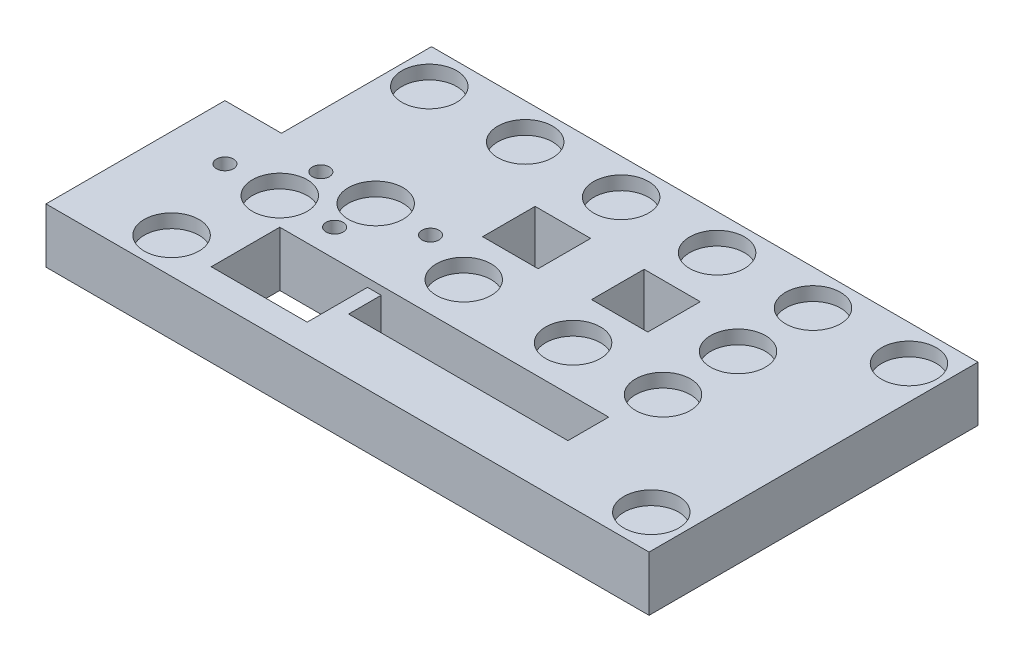
from build123d import *

# Parameters (mm, degrees)
SKETCH1_W               = 220
SKETCH1_H               = 120
BOSS_EXTRUDE1_DEPTH     = 20
CUT_EXTRUDE1_REACH      = 128.886
SKETCH2_W               = 20.632503002
SKETCH2_H               = 54.730004003
CUT_EXTRUDE2_REACH      = 128.886
SKETCH3_W               = 20.25
SKETCH3_H               = 19.16
SKETCH3_W_2             = 20.5
CUT_EXTRUDE3_REACH      = 128.886
SKETCH4_W               = 80
SKETCH4_H               = 14.88
CUT_EXTRUDE4_REACH      = 128.886
SKETCH8_R               = 3.1
CUT_EXTRUDE5_REACH      = 128.886
CUT_EXTRUDE6_DEPTH      = 127.885775404
CUT_EXTRUDE6_DEPTH_BACK = 5
SKETCH10_R              = 10


with BuildPart() as part:
    # Sketch1 → Boss-Extrude1 (new body)
    with BuildSketch(Plane(origin=(0, 0, 0), x_dir=(1, 0, 0), z_dir=(0, 1, 0))):
        Rectangle(SKETCH1_W, SKETCH1_H)
    extrude(amount=-BOSS_EXTRUDE1_DEPTH)

    # Sketch2 → Cut-Extrude1 (cut, up to next)
    with BuildSketch(Plane(origin=(0, 0, 0), x_dir=(1, 0, 0), z_dir=(0, 1, 0)), mode=Mode.PRIVATE) as cut_extrude1_sk1:
        with Locations((-99.683748499, 32.634997999)):
            Rectangle(SKETCH2_W, SKETCH2_H)
    cut_extrude1_tool1 = extrude(cut_extrude1_sk1.sketch, amount=-CUT_EXTRUDE1_REACH, mode=Mode.PRIVATE) & part.part
    add(cut_extrude1_tool1.solids().sort_by_distance((-99.683748, 0, -32.634998))[0], mode=Mode.SUBTRACT)

    # Sketch3 → Cut-Extrude2 (cut, up to next)
    with BuildSketch(Plane(origin=(0, 0, 0), x_dir=(1, 0, 0), z_dir=(0, 1, 0)), mode=Mode.PRIVATE) as cut_extrude2_sk1:
        with Locations((-9.875, 18.86)):
            Rectangle(SKETCH3_W, SKETCH3_H)
    cut_extrude2_tool1 = extrude(cut_extrude2_sk1.sketch, amount=-CUT_EXTRUDE2_REACH, mode=Mode.PRIVATE) & part.part
    # Sketch3 → Cut-Extrude2 (cut, up to next)
    with BuildSketch(Plane(origin=(0, 0, 0), x_dir=(1, 0, 0), z_dir=(0, 1, 0)), mode=Mode.PRIVATE) as cut_extrude2_sk2:
        with Locations((30, 18.86)):
            Rectangle(SKETCH3_W_2, SKETCH3_H)
    cut_extrude2_tool2 = extrude(cut_extrude2_sk2.sketch, amount=-CUT_EXTRUDE2_REACH, mode=Mode.PRIVATE) & part.part
    add(cut_extrude2_tool1.solids().sort_by_distance((-9.875, 0, -18.86))[0], mode=Mode.SUBTRACT)
    add(cut_extrude2_tool2.solids().sort_by_distance((30, 0, -18.86))[0], mode=Mode.SUBTRACT)

    # Sketch4 → Cut-Extrude3 (cut, up to next)
    with BuildSketch(Plane(origin=(0, 0, 0), x_dir=(1, 0, 0), z_dir=(0, 1, 0)), mode=Mode.PRIVATE) as cut_extrude3_sk1:
        with Locations((20, -32.16)):
            Rectangle(SKETCH4_W, SKETCH4_H)
    cut_extrude3_tool1 = extrude(cut_extrude3_sk1.sketch, amount=-CUT_EXTRUDE3_REACH, mode=Mode.PRIVATE) & part.part
    add(cut_extrude3_tool1.solids().sort_by_distance((20, 0, 32.16))[0], mode=Mode.SUBTRACT)

    # Sketch8 → Cut-Extrude4 (cut, up to next)
    with BuildSketch(Plane(origin=(0, 0, 0), x_dir=(1, 0, 0), z_dir=(0, 1, 0)), mode=Mode.PRIVATE) as cut_extrude4_sk1:
        with Locations((-90, -14.72)):
            Circle(SKETCH8_R)
    cut_extrude4_tool1 = extrude(cut_extrude4_sk1.sketch, amount=-CUT_EXTRUDE4_REACH, mode=Mode.PRIVATE) & part.part
    # Sketch8 → Cut-Extrude4 (cut, up to next)
    with BuildSketch(Plane(origin=(0, 0, 0), x_dir=(1, 0, 0), z_dir=(0, 1, 0)), mode=Mode.PRIVATE) as cut_extrude4_sk2:
        with Locations((-30, 0.28)):
            Circle(SKETCH8_R)
    cut_extrude4_tool2 = extrude(cut_extrude4_sk2.sketch, amount=-CUT_EXTRUDE4_REACH, mode=Mode.PRIVATE) & part.part
    # Sketch8 → Cut-Extrude4 (cut, up to next)
    with BuildSketch(Plane(origin=(0, 0, 0), x_dir=(1, 0, 0), z_dir=(0, 1, 0)), mode=Mode.PRIVATE) as cut_extrude4_sk3:
        with Locations((-70, 0.28)):
            Circle(SKETCH8_R)
    cut_extrude4_tool3 = extrude(cut_extrude4_sk3.sketch, amount=-CUT_EXTRUDE4_REACH, mode=Mode.PRIVATE) & part.part
    # Sketch8 → Cut-Extrude4 (cut, up to next)
    with BuildSketch(Plane(origin=(0, 0, 0), x_dir=(1, 0, 0), z_dir=(0, 1, 0)), mode=Mode.PRIVATE) as cut_extrude4_sk4:
        with Locations((-50, -14.72)):
            Circle(SKETCH8_R)
    cut_extrude4_tool4 = extrude(cut_extrude4_sk4.sketch, amount=-CUT_EXTRUDE4_REACH, mode=Mode.PRIVATE) & part.part
    add(cut_extrude4_tool1.solids().sort_by_distance((-90, 0, 14.72))[0], mode=Mode.SUBTRACT)
    add(cut_extrude4_tool2.solids().sort_by_distance((-30, 0, -0.28))[0], mode=Mode.SUBTRACT)
    add(cut_extrude4_tool3.solids().sort_by_distance((-70, 0, -0.28))[0], mode=Mode.SUBTRACT)
    add(cut_extrude4_tool4.solids().sort_by_distance((-50, 0, 14.72))[0], mode=Mode.SUBTRACT)

    # Sketch9 → Cut-Extrude5 (cut, up to next)
    with BuildSketch(Plane(origin=(0, 0, 0), x_dir=(1, 0, 0), z_dir=(0, 1, 0)), mode=Mode.PRIVATE) as cut_extrude5_sk1:
        Polygon((-20, -27.72), (-25, -27.72), (-25, -49.72), (-60, -49.72), (-60, -24.72), (-20, -24.72), align=None)
    cut_extrude5_tool1 = extrude(cut_extrude5_sk1.sketch, amount=-CUT_EXTRUDE5_REACH, mode=Mode.PRIVATE) & part.part
    add(cut_extrude5_tool1.solids().sort_by_distance((-42.162921, 0, 37.034607))[0], mode=Mode.SUBTRACT)

    # Sketch10 → Cut-Extrude6 (cut, two sides: drawn at the far end of the back side and taken through both)
    with BuildSketch(Plane(origin=(0, 0, 0), x_dir=(1, 0, 0), z_dir=(0, 1, 0)).offset(-CUT_EXTRUDE6_DEPTH_BACK)):
        with Locations((-77.183748499, 47)):
            Circle(SKETCH10_R)
        with Locations((-42.183748499, 47)):
            Circle(SKETCH10_R)
        with Locations((-7.183748499, 47)):
            Circle(SKETCH10_R)
        with Locations((27.816251501, 47)):
            Circle(SKETCH10_R)
        with Locations((62.816251501, 47)):
            Circle(SKETCH10_R)
        with Locations((97.816251501, 47)):
            Circle(SKETCH10_R)
        with Locations((30, -7.72)):
            Circle(SKETCH10_R)
        with Locations((62.816251501, 19.64)):
            Circle(SKETCH10_R)
        with Locations((-9.875, -7.72)):
            Circle(SKETCH10_R)
        with Locations((97.816251501, -47)):
            Circle(SKETCH10_R)
        with Locations((-50, 0.28)):
            Circle(SKETCH10_R)
        with Locations((62.816251501, -7.72)):
            Circle(SKETCH10_R)
        with Locations((-70, -14.72)):
            Circle(SKETCH10_R)
        with Locations((-77.183748499, -47)):
            Circle(SKETCH10_R)
    extrude(amount=CUT_EXTRUDE6_DEPTH + CUT_EXTRUDE6_DEPTH_BACK, mode=Mode.SUBTRACT)


solid = part.part
